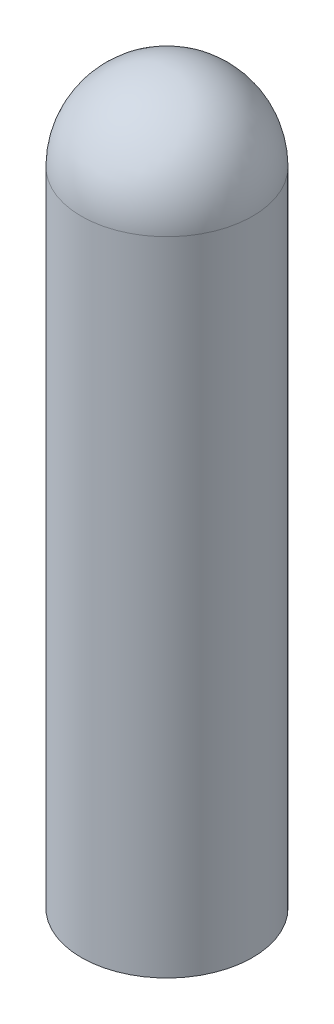
from build123d import *
from build123d.topology import SkipClean

# Parameters (mm, degrees)
SKETCH1_R           = 2
BOSS_EXTRUDE1_DEPTH = 15


with BuildPart() as part:
    # Sketch1 → Boss-Extrude1 (new body)
    with BuildSketch(Plane(origin=(0, 0, 0), x_dir=(1, 0, 0), z_dir=(0, 1, 0))):
        Circle(SKETCH1_R)
    extrude(amount=BOSS_EXTRUDE1_DEPTH)

    # Sketch2 → Revolve1 (revolve)
    with SkipClean():  # the faces are left unmerged after this step: merging them gives an invalid solid
        with BuildSketch(Plane.XY):
            with BuildLine():
                Line((2, 15), (-2, 15))
                ThreePointArc((-2, 15), (0, 17), (2, 15))
            make_face()
        revolve(axis=Axis((2, 15, 0), (-1, 0, 0)))


solid = part.part
